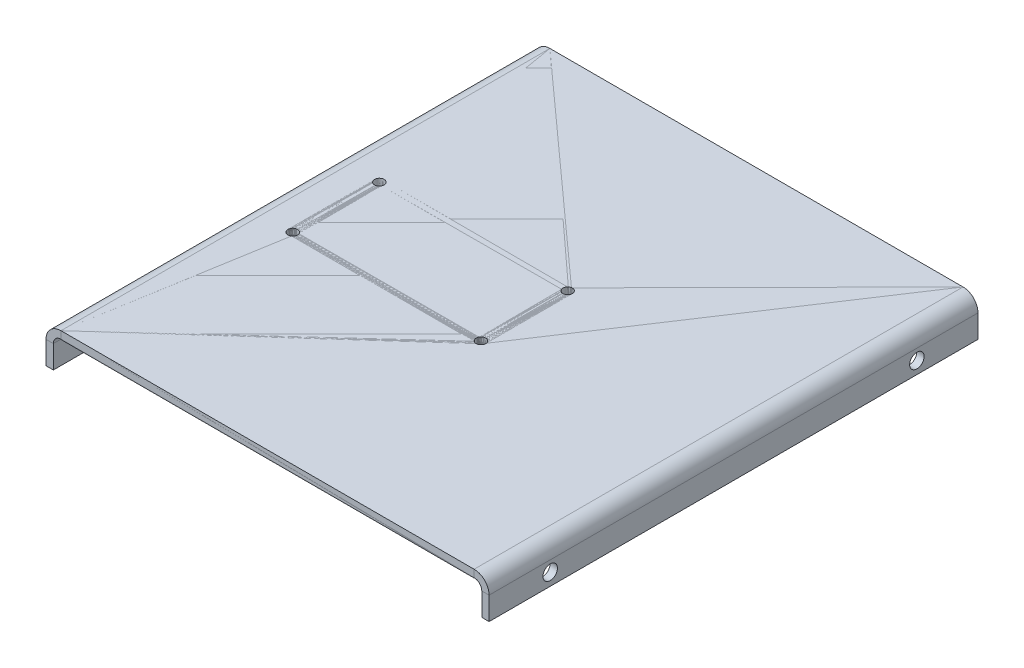
from build123d import *

# Parameters (mm, degrees)
ESQUISSE1_W                      = 85.859
ESQUISSE1_H                      = 101.6
ESQUISSE1_R                      = 1
BOSS_EXTRU_1_DEPTH               = 1.5875
CONVERTIR_VOLUME1_START          = 0.0635
CONVERTIR_VOLUME1_OUTLINE_W      = 85.859
CONVERTIR_VOLUME1_OUTLINE_H      = 101.6
CONVERTIR_VOLUME1_OUTLINE_R      = 1
CONVERTIR_VOLUME1_DEPTH          = 1.524
T_LE_PLI_E_SUR_AR_TE1_DEPTH      = 101.6
T_LE_START                       = -1.524
T_LE_PLI_E_SUR_AR_TE1_PROFILE_W  = 101.6
T_LE_PLI_E_SUR_AR_TE1_PROFILE_H  = 4.7625
T_LE_PLI_E_SUR_AR_TE1_PROFILE_R  = 1.5
T_LE_PLI_E_SUR_AR_TE1_FLAT_DEPTH = 1.524
T_LE_PLI_E_SUR_AR_TE4_DEPTH      = 101.6
T_LE_PLI_E_SUR_AR_TE4_PROFILE_W  = 101.6
T_LE_PLI_E_SUR_AR_TE4_PROFILE_H  = 4.7625
T_LE_PLI_E_SUR_AR_TE4_PROFILE_R  = 1.5
T_LE_PLI_E_SUR_AR_TE4_FLAT_DEPTH = 1.524


# Read off the part's stored shape, not the designer's step: Convertir-Volume1
# Sheet-metal steps are written as plain solids
with BuildPart() as part:
    # Esquisse1 → Boss.-Extru.1 (new body)
    with BuildSketch(Plane(origin=(0, 0, 0), x_dir=(1, 0, 0), z_dir=(0, 1, 0))):
        with Locations((42.9295, 50.8)):
            Rectangle(ESQUISSE1_W, ESQUISSE1_H)
        with Locations(Location((6.35, 59.817, 0), (0, 0, 270))):
            Circle(ESQUISSE1_R, mode=Mode.SUBTRACT)
        with Locations(Location((45.466, 59.817, 0), (0, 0, 270))):
            Circle(ESQUISSE1_R, mode=Mode.SUBTRACT)
        with Locations(Location((45.466, 41.817, 0), (0, 0, 90))):
            Circle(ESQUISSE1_R, mode=Mode.SUBTRACT)
        with Locations(Location((6.35, 41.817, 0), (0, 0, 90))):
            Circle(ESQUISSE1_R, mode=Mode.SUBTRACT)
    extrude(amount=BOSS_EXTRU_1_DEPTH)


with BuildPart() as body_2:
    # Convertir-Volume1 outline → Convertir-Volume1 (new body)
    with BuildSketch(Plane(origin=(0, 0, 0), x_dir=(1, 0, 0), z_dir=(0, 1, 0)).offset(CONVERTIR_VOLUME1_START)):
        with Locations((42.9295, 50.8)):
            Rectangle(CONVERTIR_VOLUME1_OUTLINE_W, CONVERTIR_VOLUME1_OUTLINE_H)
        with Locations((6.35, 41.817)):
            Circle(CONVERTIR_VOLUME1_OUTLINE_R, mode=Mode.SUBTRACT)
        with Locations((45.466, 41.817)):
            Circle(CONVERTIR_VOLUME1_OUTLINE_R, mode=Mode.SUBTRACT)
        with Locations((6.35, 59.817)):
            Circle(CONVERTIR_VOLUME1_OUTLINE_R, mode=Mode.SUBTRACT)
        with Locations((45.466, 59.817)):
            Circle(CONVERTIR_VOLUME1_OUTLINE_R, mode=Mode.SUBTRACT)
    extrude(amount=CONVERTIR_VOLUME1_DEPTH)

    # Tôle pliée sur arête1 bend section (across the edge) → Tôle pliée sur arête1 (add)
    with BuildSketch(Plane(origin=(-1.5875, 0.0635, 0), x_dir=(1, 0, 0), z_dir=(0, 0, -1))):
        with BuildLine():
            Line((-1.524, 1.5875), (0, 1.5875))
            ThreePointArc((0, 1.5875), (0.464967985, 0.464967985), (1.5875, 0))
            Line((1.5875, 0), (1.5875, -1.524))
            ThreePointArc((1.5875, -1.524), (-0.61266275, -0.61266275), (-1.524, 1.5875))
        make_face()
    extrude(amount=T_LE_PLI_E_SUR_AR_TE1_DEPTH)

    # Tôle pliée sur arête1 profile (on flange) → Tôle pliée sur arête1 flat (add)
    with BuildSketch(Plane(origin=(-1.5875, 0.0635, 0), x_dir=(0, 0, 1), z_dir=(1, 0, 0)).offset(T_LE_START)):
        with Locations((-50.8, 3.96875)):
            Rectangle(T_LE_PLI_E_SUR_AR_TE1_PROFILE_W, T_LE_PLI_E_SUR_AR_TE1_PROFILE_H)
        with Locations((-12.7, 3.81)):
            Circle(T_LE_PLI_E_SUR_AR_TE1_PROFILE_R, mode=Mode.SUBTRACT)
        with Locations((-88.9, 3.81)):
            Circle(T_LE_PLI_E_SUR_AR_TE1_PROFILE_R, mode=Mode.SUBTRACT)
    extrude(amount=T_LE_PLI_E_SUR_AR_TE1_FLAT_DEPTH)

    # Tôle pliée sur arête4 bend section (across the edge) → Tôle pliée sur arête4 (add)
    with BuildSketch(Plane(origin=(87.4465, 0.0635, -101.6), x_dir=(-1, 0, 0), z_dir=(0, 0, 1))):
        with BuildLine():
            Line((-1.524, 1.5875), (0, 1.5875))
            ThreePointArc((0, 1.5875), (0.464967985, 0.464967985), (1.5875, 0))
            Line((1.5875, 0), (1.5875, -1.524))
            ThreePointArc((1.5875, -1.524), (-0.61266275, -0.61266275), (-1.524, 1.5875))
        make_face()
    extrude(amount=T_LE_PLI_E_SUR_AR_TE4_DEPTH)

    # Tôle pliée sur arête4 profile (on flange) → Tôle pliée sur arête4 flat (add)
    with BuildSketch(Plane(origin=(87.4465, 0.0635, 0), x_dir=(0, 0, -1), z_dir=(-1, 0, 0)).offset(T_LE_START)):
        with Locations((50.8, 3.96875)):
            Rectangle(T_LE_PLI_E_SUR_AR_TE4_PROFILE_W, T_LE_PLI_E_SUR_AR_TE4_PROFILE_H)
        with Locations((12.7, 3.81)):
            Circle(T_LE_PLI_E_SUR_AR_TE4_PROFILE_R, mode=Mode.SUBTRACT)
        with Locations((88.9, 3.81)):
            Circle(T_LE_PLI_E_SUR_AR_TE4_PROFILE_R, mode=Mode.SUBTRACT)
    extrude(amount=T_LE_PLI_E_SUR_AR_TE4_FLAT_DEPTH)


solid = Compound([part.part, body_2.part])
